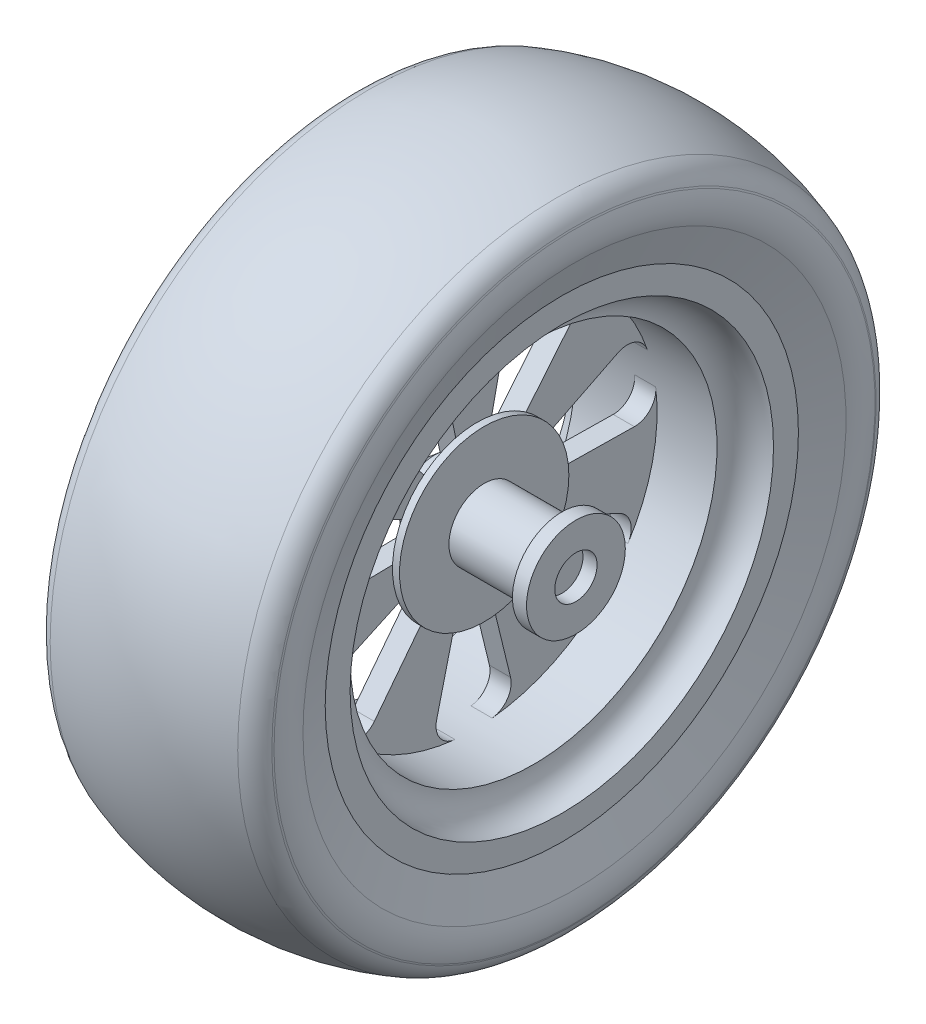
from build123d import *

# Parameters (mm, degrees)
BOSS_EXTRUDE1_DEPTH      = 70
BOSS_EXTRUDE1_DEPTH_BACK = 20
SKETCH2_R                = 25
SKETCH3_R                = 25
BOSS_EXTRUDE2_DEPTH      = 15
BOSS_EXTRUDE2_TAPER      = 40
BOSS_EXTRUDE3_DEPTH      = 7.5
CIRPATTERN1_START        = -7.5
CIRPATTERN1_DEPTH        = 15
FILLET1_R                = 15
FILLET2_R                = 6.5
CUT_EXTRUDE5_START       = -20
CUT_EXTRUDE5_DEPTH       = 20
CIRPATTERN2_START        = -7.5
CIRPATTERN2_DEPTH        = 7.5
BOSS_EXTRUDE4_START      = -60
BOSS_EXTRUDE4_OUTLINE_R  = 60
BOSS_EXTRUDE4_DEPTH      = 5
SKETCH9_R                = 35
BOSS_EXTRUDE5_DEPTH      = 10
SKETCH10_R               = 15
CUT_EXTRUDE6_DEPTH       = 10


# Read off the part's stored shape, not the designer's step: CirPattern1, CirPattern2, Boss-Extrude4
with BuildPart() as part:
    # Sketch1 → Revolve2 (revolve)
    with BuildSketch(Plane.XY, mode=Mode.PRIVATE) as revolve2_sk:
        with BuildLine():
            Line((-50, 130), (50, 130))
            ThreePointArc((50, 130), (55.857864376, 144.142135624), (70, 150))
            Line((70, 150), (70, 167.650273224))
            Line((70, 167.650273224), (65, 167.650273224))
            Line((65, 167.650273224), (65, 154.494897428))
            ThreePointArc((65, 154.494897428), (52.32233047, 147.67766953), (45.505102572, 135))
            Line((45.505102572, 135), (-45.505102572, 135))
            ThreePointArc((-45.505102572, 135), (-52.32233047, 147.67766953), (-65, 154.494897428))
            Line((-65, 154.494897428), (-65, 167.650273224))
            Line((-65, 167.650273224), (-70, 167.650273224))
            Line((-70, 167.650273224), (-70, 150))
            ThreePointArc((-70, 150), (-55.857864376, 144.142135624), (-50, 130))
        make_face()
    revolve(revolve2_sk.sketch.rotate(Axis((0, 0, 0), (1, 0, 0)), 90), axis=Axis((0, 0, 0), (1, 0, 0)))

    # Sketch4 → Revolve3 (revolve)
    with BuildSketch(Plane.XY, mode=Mode.PRIVATE) as revolve3_sk:
        with BuildLine():
            Line((65, 152.57921019), (65, 167.650273224))
            Line((65, 167.650273224), (70, 167.650273224))
            Line((70, 167.650273224), (79.004403649, 192.389668924))
            ThreePointArc((79.004403649, 192.389668924), (80.813625025, 202.650273224), (79.004403649, 212.910877524))
            Line((79.004403649, 212.910877524), (78.589834596, 214.049896633))
            ThreePointArc((78.589834596, 214.049896633), (73.864168395, 221.425194124), (66.439980201, 226.073673853))
            ThreePointArc((66.439980201, 226.073673853), (0, 237.431872995), (-66.439980201, 226.073673853))
            ThreePointArc((-66.439980201, 226.073673853), (-73.864168395, 221.425194124), (-78.589834596, 214.049896633))
            Line((-78.589834596, 214.049896633), (-79.004403649, 212.910877524))
            ThreePointArc((-79.004403649, 212.910877524), (-80.813625025, 202.650273224), (-79.004403649, 192.389668924))
            Line((-79.004403649, 192.389668924), (-70, 167.650273224))
            Line((-70, 167.650273224), (-65, 167.650273224))
            Line((-65, 167.650273224), (-65, 152.57921019))
            Line((-65, 152.57921019), (-60, 152.57921019))
            Line((-60, 152.57921019), (-60, 172.650273224))
            Line((-60, 172.650273224), (-66.498962309, 172.650273224))
            Line((-66.498962309, 172.650273224), (-74.305940545, 194.099769641))
            ThreePointArc((-74.305940545, 194.099769641), (-75.813625025, 202.650273224), (-74.305940545, 211.200776807))
            Line((-74.305940545, 211.200776807), (-73.891371493, 212.339795917))
            ThreePointArc((-73.891371493, 212.339795917), (-70.347121841, 217.871269035), (-64.778980696, 221.357628831))
            ThreePointArc((-64.778980696, 221.357628831), (0, 232.431872995), (64.778980696, 221.357628831))
            ThreePointArc((64.778980696, 221.357628831), (70.347121841, 217.871269035), (73.891371493, 212.339795917))
            Line((73.891371493, 212.339795917), (74.305940545, 211.200776807))
            ThreePointArc((74.305940545, 211.200776807), (75.813625025, 202.650273224), (74.305940545, 194.099769641))
            Line((74.305940545, 194.099769641), (66.498962309, 172.650273224))
            Line((66.498962309, 172.650273224), (60, 172.650273224))
            Line((60, 172.650273224), (60, 152.57921019))
            Line((60, 152.57921019), (65, 152.57921019))
        make_face()
    revolve(revolve3_sk.sketch.rotate(Axis((0, 0, 0), (1, 0, 0)), 90), axis=Axis((0, 0, 0), (1, 0, 0)))



with BuildPart() as body_2:
    # Sketch2 → Boss-Extrude1 (new, two sides: drawn at the far end of the back side and taken through both)
    with BuildSketch(Plane(origin=(0, 0, 0), x_dir=(0, 0, -1), z_dir=(1, 0, 0)).offset(-BOSS_EXTRUDE1_DEPTH_BACK)):
        Circle(SKETCH2_R)
    extrude(amount=BOSS_EXTRUDE1_DEPTH + BOSS_EXTRUDE1_DEPTH_BACK)

    # Sketch3 → Boss-Extrude2 (add)
    with BuildSketch(Plane.ZY.offset(20)):
        with Locations(Location((0, 0, 0), (0, 0, 180))):
            Circle(SKETCH3_R)
    extrude(amount=BOSS_EXTRUDE2_DEPTH, taper=BOSS_EXTRUDE2_TAPER)


with BuildPart() as part_1:
    add(part.part)

    add(body_2.part)  # Boss-Extrude3 merges body 2
    # Sketch5 → Boss-Extrude3 (add, symmetric)
    with BuildSketch(Plane(origin=(0, 0, 0), x_dir=(0, 0, -1), z_dir=(1, 0, 0))):
        with BuildLine():
            Line((-6, 24.269322199), (-27.833003207, 126.985526468))
            ThreePointArc((-27.833003207, 126.985526468), (0, 130), (27.833003207, 126.985526468))
            Line((27.833003207, 126.985526468), (6, 24.269322199))
            ThreePointArc((6, 24.269322199), (0, 25), (-6, 24.269322199))
        make_face()
    extrude(amount=BOSS_EXTRUDE3_DEPTH, both=True)

    # CirPattern1 outline → CirPattern1 (add)
    with BuildSketch(Plane.YZ.offset(CIRPATTERN1_START)):
        with BuildLine():
            Line((10.440685994, -22.715458965), (57.413462578, -116.634876066))
            ThreePointArc((57.413462578, -116.634876066), (81.053674242, -101.638092721), (100.934898896, -81.927688756))
            Line((100.934898896, -81.927688756), (19.822663784, -15.233581342))
            ThreePointArc((19.822663784, -15.233581342), (15.587245046, -19.545787062), (10.440685994, -22.715458965))
        make_face()
        with BuildLine():
            ThreePointArc((-55.392109655, -117.608308329), (-28.927721414, -126.740628584), (-1.121766242, -129.995160066))
            Line((-1.121766242, -129.995160066), (0.449135231, -24.995965225))
            ThreePointArc((0.449135231, -24.995965225), (-5.563023349, -24.373197805), (-11.249999715, -22.325714018))
            Line((-11.249999715, -22.325714018), (-55.392109655, -117.608308329))
        make_face()
        with BuildLine():
            ThreePointArc((-126.486293525, -30.020285648), (-117.125952827, -56.404886085), (-102.33371852, -80.173624428))
            Line((-102.33371852, -80.173624428), (-19.262601312, -15.935877469))
            ThreePointArc((-19.262601312, -15.935877469), (-22.524221698, -10.847093478), (-24.469206181, -5.124251054))
            Line((-24.469206181, -5.124251054), (-126.486293525, -30.020285648))
        make_face()
        with BuildLine():
            Line((19.822663784, 15.233581342), (100.934898896, 81.927688756))
            ThreePointArc((100.934898896, 81.927688756), (81.053674242, 101.638092721), (57.413462578, 116.634876066))
            Line((57.413462578, 116.634876066), (10.440685994, 22.715458965))
            ThreePointArc((10.440685994, 22.715458965), (15.587245046, 19.545787062), (19.822663784, 15.233581342))
        make_face()
        with BuildLine():
            ThreePointArc((-102.33371852, 80.173624428), (-117.125952827, 56.404886085), (-126.486293525, 30.020285648))
            Line((-126.486293525, 30.020285648), (-24.469206181, 5.124251054))
            ThreePointArc((-24.469206181, 5.124251054), (-22.524221698, 10.847093478), (-19.262601312, 15.935877469))
            Line((-19.262601312, 15.935877469), (-102.33371852, 80.173624428))
        make_face()
        with BuildLine():
            Line((0.449135231, 24.995965225), (-1.121766242, 129.995160066))
            ThreePointArc((-1.121766242, 129.995160066), (-28.927721414, 126.740628584), (-55.392109655, 117.608308329))
            Line((-55.392109655, 117.608308329), (-11.249999715, 22.325714018))
            ThreePointArc((-11.249999715, 22.325714018), (-5.563023349, 24.373197805), (0.449135231, 24.995965225))
        make_face()
    extrude(amount=CIRPATTERN1_DEPTH)

    # Fillet1
    # the kernel refuses this fillet: 15 mm, written as the material it adds along each edge
    with BuildSketch(Plane(origin=(-7.5, -1.121766242, 129.995160066), x_dir=(0, 0.014959407015905963, -0.9998881018102637), z_dir=(1, 0, 0)), Plane(origin=(-7.5, 57.413462578, -116.634876066), x_dir=(0, -0.4473131483213439, 0.8943774076634804), z_dir=(1, 0, 0)), Plane(origin=(-7.5, -126.486293525, -30.020285648), x_dir=(0, 0.9714900382926073, 0.2370803777165635), z_dir=(1, 0, 0))) as fillet1_piece_1:
        with BuildLine():
            CenterArc((16.091151069, 15), FILLET1_R, 172.091505789, 97.908494211)
            ThreePointArc((1.23381493, 17.063870842), (0.335895406, 8.552254192), (0, 0))
            Line((0, 0), (16.091151069, 0))
        make_face()
    extrude(amount=15)
    with BuildSketch(Plane(origin=(-7.5, -55.392109655, 117.608308329), x_dir=(0, 0.42035722830881256, -0.9073586945682137), z_dir=(1, 0, 0)), Plane(origin=(-7.5, 126.985526468, 27.833003207), x_dir=(0, -0.9781476007338056, -0.20791169081775962), z_dir=(1, 0, 0)), Plane(origin=(-7.5, -102.33371852, -80.173624428), x_dir=(0, 0.7910710346558518, 0.6117242991156392), z_dir=(1, 0, 0))) as fillet1_piece_2:
        with BuildLine():
            CenterArc((16.091151068, -15), FILLET1_R, 90, 97.908494211)
            ThreePointArc((1.233814929, -17.063870842), (0.335895406, -8.552254192), (0, 0))
            Line((0, 0), (16.091151068, 0))
        make_face()
    extrude(amount=15)
    with BuildSketch(Plane(origin=(-7.5, 100.934898896, 81.927688756), x_dir=(0, -0.772416959223735, -0.6351157698432303), z_dir=(1, 0, 0))) as fillet1_piece_3:
        with BuildLine():
            CenterArc((16.091151068, 15), FILLET1_R, 172.091505789, 97.908494211)
            ThreePointArc((1.23381493, 17.063870842), (0.335895406, 8.552254192), (0, 0))
            Line((0, 0), (16.091151068, 0))
        make_face()
    extrude(amount=15)
    with BuildSketch(Plane(origin=(-7.5, 57.413462578, 116.634876066), x_dir=(0, -0.4473131483213439, -0.8943774076634804), z_dir=(1, 0, 0)), Plane(origin=(-7.5, -1.121766242, -129.995160066), x_dir=(0, 0.014959407015905866, 0.9998881018102637), z_dir=(1, 0, 0)), Plane(origin=(-7.5, -126.486293525, 30.020285648), x_dir=(0, 0.9714900382926075, -0.23708037771656312), z_dir=(1, 0, 0))) as fillet1_piece_4:
        with BuildLine():
            CenterArc((16.091151069, -15), FILLET1_R, 90, 97.908494211)
            ThreePointArc((1.23381493, -17.063870842), (0.335895406, -8.552254192), (0, 0))
            Line((0, 0), (16.091151069, 0))
        make_face()
    extrude(amount=15)
    with BuildSketch(Plane(origin=(-7.5, 126.985526468, -27.833003207), x_dir=(0, -0.9781476007338055, 0.20791169081775937), z_dir=(1, 0, 0)), Plane(origin=(-7.5, -55.392109655, -117.608308329), x_dir=(0, 0.4203572283088129, 0.9073586945682134), z_dir=(1, 0, 0)), Plane(origin=(-7.5, -102.33371852, 80.173624428), x_dir=(0, 0.7910710346558513, -0.61172429911564), z_dir=(1, 0, 0))) as fillet1_piece_5:
        with BuildLine():
            CenterArc((16.091151068, 15), FILLET1_R, 172.091505789, 97.908494211)
            ThreePointArc((1.233814929, 17.063870842), (0.335895406, 8.552254192), (0, 0))
            Line((0, 0), (16.091151068, 0))
        make_face()
    extrude(amount=15)
    with BuildSketch(Plane(origin=(-7.5, 100.934898896, -81.927688756), x_dir=(0, -0.7724169592237349, 0.6351157698432305), z_dir=(1, 0, 0))) as fillet1_piece_6:
        with BuildLine():
            CenterArc((16.091151068, -15), FILLET1_R, 90, 97.908494211)
            ThreePointArc((1.23381493, -17.063870842), (0.335895406, -8.552254192), (0, 0))
            Line((0, 0), (16.091151068, 0))
        make_face()
    extrude(amount=15)

    # Fillet2
    fillet2_edges = [part_1.edges().sort_by_distance(p)[0] for p in [
        (0, -11.249999715, 22.325714018),
        (0, 0.449135231, 24.995965225),
        (0, 10.440685994, 22.715458965),
        (0, 19.822663784, 15.233581342),
        (0, 24.269322199, 6),
        (0, 24.269322199, -6),
        (0, 19.822663784, -15.233581342),
        (0, 10.440685994, -22.715458965),
        (0, 0.449135231, -24.995965225),
        (0, -11.249999715, -22.325714018),
        (0, -19.262601312, -15.935877469),
        (0, -24.469206181, -5.124251054),
        (0, -24.469206181, 5.124251054),
        (0, -19.262601312, 15.935877469),
    ]]
    fillet(fillet2_edges, radius=FILLET2_R)

    # Sketch6 → Cut-Extrude5 (cut)
    with BuildSketch(Plane(origin=(0, 0, 0), x_dir=(0, 0, -1), z_dir=(1, 0, 0)).offset(CUT_EXTRUDE5_START)):
        with BuildLine():
            Line((-16.095201307, 95.812267389), (-2.183545012, 30.832635562))
            ThreePointArc((-2.183545012, 30.832635562), (0.051590228, 29.026732899), (2.284069915, 30.83591736))
            Line((2.284069915, 30.83591736), (16.100246424, 95.83591736))
            ThreePointArc((16.100246424, 95.83591736), (-0.012091054, 115.718061447), (-16.095201307, 95.812267389))
        make_face()
    extrude(amount=CUT_EXTRUDE5_DEPTH, mode=Mode.SUBTRACT)

    # CirPattern2 outline → CirPattern2 (cut)
    with BuildSketch(Plane.YZ.offset(CIRPATTERN2_START)):
        with BuildLine():
            ThreePointArc((17.516669604, 25.467343216), (18.138206809, 22.661847632), (21.011637773, 22.684396684))
            Line((21.011637773, 22.684396684), (72.340396655, 64.889197891))
            ThreePointArc((72.340396655, 64.889197891), (72.139578037, 90.479562178), (47.154236512, 84.944240925))
            Line((47.154236512, 84.944240925), (17.516669604, 25.467343216))
        make_face()
        with BuildLine():
            ThreePointArc((-8.989705841, 29.57371254), (-6.408758961, 28.310452009), (-4.634833617, 30.571049903))
            Line((-4.634833617, 30.571049903), (-5.628918206, 97.015752695))
            ThreePointArc((-5.628918206, 97.015752695), (-25.761479015, 112.814077536), (-37.01189623, 89.82853458))
            Line((-37.01189623, 89.82853458), (-8.989705841, 29.57371254))
        make_face()
        with BuildLine():
            ThreePointArc((-28.726649431, 11.410473127), (-26.129798518, 12.640708594), (-26.791180759, 15.437079009))
            Line((-26.791180759, 15.437079009), (-79.359542849, 56.087466959))
            ThreePointArc((-79.359542849, 56.087466959), (-104.263616929, 50.197291521), (-93.307316206, 27.070109528))
            Line((-93.307316206, 27.070109528), (-28.726649431, 11.410473127))
        make_face()
        with BuildLine():
            ThreePointArc((-26.831840082, -15.345085282), (-26.17456684, -12.547746215), (-28.77322235, -11.321327238))
            Line((-28.77322235, -11.321327238), (-93.330813087, -27.075825373))
            ThreePointArc((-93.330813087, -27.075825373), (-104.253124706, -50.219078847), (-79.340423956, -56.072660128))
            Line((-79.340423956, -56.072660128), (-26.831840082, -15.345085282))
        make_face()
        with BuildLine():
            ThreePointArc((-4.732107882, -30.545481491), (-6.509352467, -28.287492197), (-9.088440644, -29.554543161))
            Line((-9.088440644, -29.554543161), (-37.022077469, -89.850468953))
            ThreePointArc((-37.022077469, -89.850468953), (-25.737903203, -112.819458561), (-5.628574218, -96.991573034))
            Line((-5.628574218, -96.991573034), (-4.732107882, -30.545481491))
        make_face()
        with BuildLine():
            ThreePointArc((20.930998071, -22.744507123), (18.05753708, -22.726179595), (17.440122237, -25.532585282))
            Line((17.440122237, -25.532585282), (47.165037596, -84.965876796))
            ThreePointArc((47.165037596, -84.965876796), (72.158484369, -90.464484881), (72.321706708, -64.873853178))
            Line((72.321706708, -64.873853178), (20.930998071, -22.744507123))
        make_face()
    extrude(amount=CIRPATTERN2_DEPTH, mode=Mode.SUBTRACT)

    # Boss-Extrude4 outline → Boss-Extrude4 (add)
    with BuildSketch(Plane(origin=(70, 0, 0), x_dir=(0, 0, -1), z_dir=(1, 0, 0)).offset(BOSS_EXTRUDE4_START)):
        Circle(BOSS_EXTRUDE4_OUTLINE_R)
    extrude(amount=BOSS_EXTRUDE4_DEPTH)

    # Sketch9 → Boss-Extrude5 (add)
    with BuildSketch(Plane(origin=(70, 0, 0), x_dir=(0, 0, -1), z_dir=(1, 0, 0))):
        Circle(SKETCH9_R)
    extrude(amount=BOSS_EXTRUDE5_DEPTH)

    # Sketch10 → Cut-Extrude6 (cut)
    with BuildSketch(Plane(origin=(80, 0, 0), x_dir=(0, 0, -1), z_dir=(1, 0, 0))):
        Circle(SKETCH10_R)
    extrude(amount=-CUT_EXTRUDE6_DEPTH, mode=Mode.SUBTRACT)


solid = part_1.part
